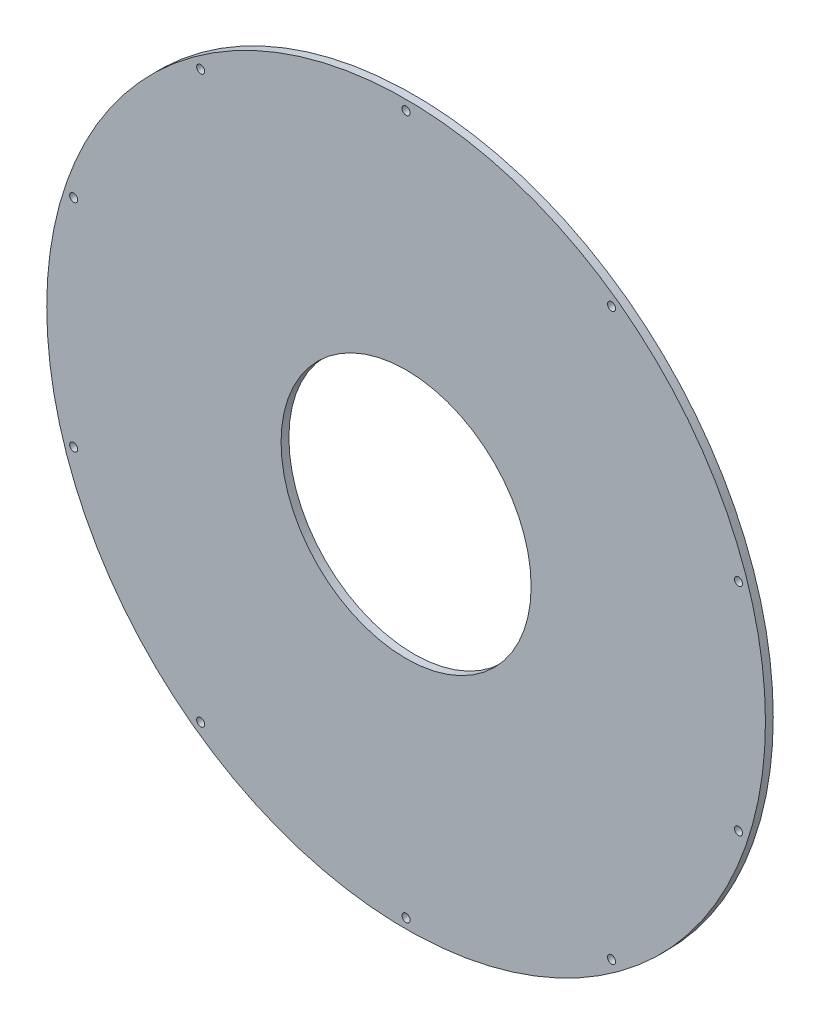
from build123d import *

# Parameters (mm, degrees)
SKETCH1_R             = 146
SKETCH1_R_2           = 50.8
BOSS_EXTRUDE1_DEPTH   = 3.175
F_4_CLEARANCE_HOLE1_D = 3.2639
CIRPATTERN1_COUNT     = 10


with BuildPart() as part:
    # Sketch1 → Boss-Extrude1 (new body)
    with BuildSketch(Plane.XY):
        Circle(SKETCH1_R)
        Circle(SKETCH1_R_2, mode=Mode.SUBTRACT)
    extrude(amount=BOSS_EXTRUDE1_DEPTH)

    # #4 Clearance Hole1 (through all)
    with Locations(Plane.XY.offset(3.175)):
        with Locations((0, 142)):
            f_4_clearance_hole1 = Hole(F_4_CLEARANCE_HOLE1_D / 2)

    # CirPattern1: #4 Clearance Hole1 ×10 about axis
    cirpattern1_axis = Axis((0, 0, 3.175), (0, 0, -1))
    for i in range(1, CIRPATTERN1_COUNT):
        add(f_4_clearance_hole1.rotate(cirpattern1_axis, i * 360 / CIRPATTERN1_COUNT), mode=Mode.SUBTRACT)


solid = part.part
